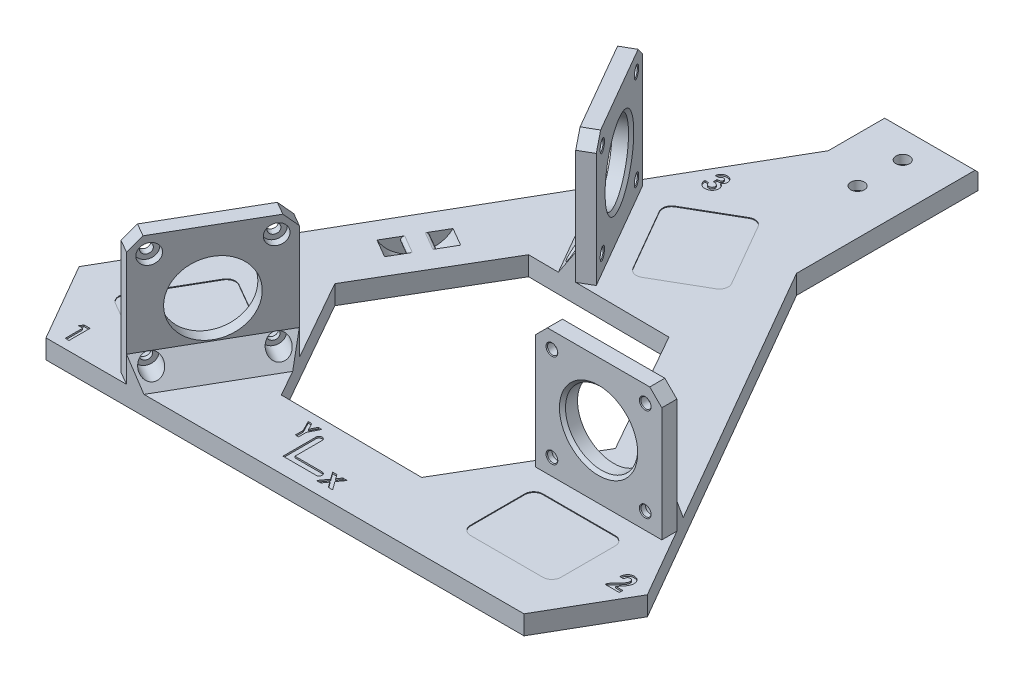
from build123d import *

# Parameters (mm, degrees)
SKETCH1_W                    = 555
SKETCH1_H                    = 555
BOSS_EXTRUDE1_DEPTH          = 6.35
SKETCH4_W                    = 42
SKETCH4_H                    = 5
BOSS_EXTRUDE3_DEPTH          = 42
SKETCH5_R                    = 12
CUT_EXTRUDE1_DEPTH           = 42
CHAMFER2_SIZE                = 1
CHAMFER1_SIZE                = 4
CUT_EXTRUDE7_DEPTH           = 0.25
CIRPATTERN2_COUNT            = 3
CHAMFER2_OF_CIRPATTERN2_SIZE = 1
CHAMFER1_OF_CIRPATTERN2_SIZE = 4
CUT_EXTRUDE2_DEPTH           = 10
SKETCH12_W                   = 555
SKETCH12_H                   = 555
CUT_EXTRUDE3_DEPTH           = 10
CHAMFER3_SIZE                = 30
CHAMFER3_EDGE_2_SIZE         = 30
CHAMFER3_EDGE_3_SIZE         = 30
CHAMFER4_SIZE                = 5
CHAMFER4_SIZE_2              = 8.660254038
MOVE_FACE2_BY                = 0.75
MOVE_FACE2_2_BY              = 0.75
MOVE_FACE3_BY                = 0.75
MOVE_FACE3_2_BY              = 0.75
MOVE_FACE4_BY                = 0.75
MOVE_FACE4_2_BY              = 0.75
SKETCH24_R                   = 10.5
SKETCH24_R_2                 = 7.5
CUT_EXTRUDE6_DEPTH           = 3.5
FILLET2_R                    = 1
CUT_EXTRUDE8_DEPTH           = 0.5
BOSS_EXTRUDE7_DEPTH          = 6.35
CHAMFER7_SIZE                = 1
M4_CLEARANCE_HOLE1_D         = 4.5
CUT_EXTRUDE9_DEPTH           = 3.3
CHAMFER8_SIZE                = 0.5
CHAMFER9_SIZE                = 11.5
CHAMFER9_SIZE2               = 19.918584287
DELETEFACE1_START            = -63.148057707
DELETEFACE1_DEPTH            = 0.173205081
CUT_EXTRUDE10_START          = 175.99903753
CUT_EXTRUDE10_DEPTH          = 176.19903753
LPATTERN1_COUNT              = 2
LPATTERN1_PITCH              = 15


with BuildPart() as part:
    # Sketch1 → Boss-Extrude1 (new body)
    with BuildSketch(Plane(origin=(0, 0, 0), x_dir=(1, 0, 0), z_dir=(0, 1, 0))):
        Rectangle(SKETCH1_W, SKETCH1_H)
    extrude(amount=BOSS_EXTRUDE1_DEPTH)

    # Sketch4 → Boss-Extrude3 (add)
    with BuildSketch(Plane(origin=(0, 6.35, 0), x_dir=(1, 0, 0), z_dir=(0, 1, 0))):
        with Locations((60, -16.5)):
            Rectangle(SKETCH4_W, SKETCH4_H)
    boss_extrude3 = extrude(amount=BOSS_EXTRUDE3_DEPTH)

    # Sketch5 → Cut-Extrude1 (cut)
    with BuildSketch(Plane.XY.offset(19)):
        with Locations((60, 27.35)):
            Circle(SKETCH5_R)
    cut_extrude1 = extrude(amount=-CUT_EXTRUDE1_DEPTH, mode=Mode.SUBTRACT)

    # CBORE for M3 SHCS1: read off the stored shape, not the designer's step
    # CBORE for M3 SHCS1 outline → CBORE for M3 SHCS1 (revolve, cut)
    with BuildSketch(Plane(origin=(75.5, 11.85, 0), x_dir=(1, 0, 0), z_dir=(0, -1, 0))):
        Polygon((1.95, 19), (0, 19), (0, 14), (3.25, 14), (3.25, 16.5), (1.7, 16.5), (1.7, 18.75), align=None)
    cbore_for_m3_shcs1 = revolve(axis=Axis((75.5, 11.85, 0), (0, 0, 1)), mode=Mode.SUBTRACT)

    # CBORE for M3 SHCS1 2 outline → CBORE for M3 SHCS1 2 (revolve, cut)
    with BuildSketch(Plane(origin=(44.5, 42.85, 0), x_dir=(1, 0, 0), z_dir=(0, -1, 0))):
        Polygon((0, 14), (3.25, 14), (3.25, 16.5), (1.7, 16.5), (1.7, 18.75), (1.95, 19), (0, 19), align=None)
    cbore_for_m3_shcs1_2 = revolve(axis=Axis((44.5, 42.85, 0), (0, 0, 1)), mode=Mode.SUBTRACT)

    # CBORE for M3 SHCS1 3 outline → CBORE for M3 SHCS1 3 (revolve, cut)
    with BuildSketch(Plane(origin=(44.5, 11.85, 0), x_dir=(1, 0, 0), z_dir=(0, -1, 0))):
        Polygon((0, 14), (3.25, 14), (3.25, 16.5), (1.7, 16.5), (1.7, 18.75), (1.95, 19), (0, 19), align=None)
    cbore_for_m3_shcs1_3 = revolve(axis=Axis((44.5, 11.85, 0), (0, 0, 1)), mode=Mode.SUBTRACT)

    # CBORE for M3 SHCS1 4 outline → CBORE for M3 SHCS1 4 (revolve, cut)
    with BuildSketch(Plane(origin=(75.5, 42.85, 0), x_dir=(1, 0, 0), z_dir=(0, -1, 0))):
        Polygon((0, 14), (3.25, 14), (3.25, 16.5), (1.7, 16.5), (1.7, 18.75), (1.95, 19), (0, 19), align=None)
    cbore_for_m3_shcs1_4 = revolve(axis=Axis((75.5, 42.85, 0), (0, 0, 1)), mode=Mode.SUBTRACT)

    # Chamfer2
    chamfer2_edges = [part.edges().sort_by_distance(p)[0] for p in [
        (48, 27.35, 19),
    ]]
    chamfer(chamfer2_edges, length=CHAMFER2_SIZE)

    # Chamfer1
    chamfer1_edges = [part.edges().sort_by_distance(p)[0] for p in [
        (81, 48.35, 16.5),
        (39, 48.35, 16.5),
    ]]
    chamfer(chamfer1_edges, length=CHAMFER1_SIZE)

    # Sketch25 → Cut-Extrude7 (cut)
    with BuildSketch(Plane(origin=(0, 6.35, 0), x_dir=(1, 0, 0), z_dir=(0, 1, 0))):
        with BuildLine():
            Line((48, -49.5), (72, -49.5))
            ThreePointArc((72, -49.5), (74.121320344, -48.621320344), (75, -46.5))
            Line((75, -46.5), (75, -28.5))
            ThreePointArc((75, -28.5), (74.121320344, -26.378679656), (72, -25.5))
            Line((72, -25.5), (48, -25.5))
            ThreePointArc((48, -25.5), (45.878679656, -26.378679656), (45, -28.5))
            Line((45, -28.5), (45, -46.5))
            ThreePointArc((45, -46.5), (45.878679656, -48.621320344), (48, -49.5))
        make_face()
    cut_extrude7 = extrude(amount=-CUT_EXTRUDE7_DEPTH, mode=Mode.SUBTRACT)

    # CirPattern2: Boss-Extrude3, Cut-Extrude1, CBORE for M3 SHCS1, CBORE for M3 SHCS1 2, CBORE for M3 SHCS1 3, CBORE for M3 SHCS1 4, Cut-Extrude7 ×3 about axis
    cirpattern2_axis = Axis((0, 0, 0), (0, 1, 0))
    add([boss_extrude3.rotate(cirpattern2_axis, i * 360 / CIRPATTERN2_COUNT) for i in range(1, CIRPATTERN2_COUNT)])
    add([cut_extrude1.rotate(cirpattern2_axis, i * 360 / CIRPATTERN2_COUNT) for i in range(1, CIRPATTERN2_COUNT)], mode=Mode.SUBTRACT)
    add([cbore_for_m3_shcs1.rotate(cirpattern2_axis, i * 360 / CIRPATTERN2_COUNT) for i in range(1, CIRPATTERN2_COUNT)], mode=Mode.SUBTRACT)
    add([cbore_for_m3_shcs1_2.rotate(cirpattern2_axis, i * 360 / CIRPATTERN2_COUNT) for i in range(1, CIRPATTERN2_COUNT)], mode=Mode.SUBTRACT)
    add([cbore_for_m3_shcs1_3.rotate(cirpattern2_axis, i * 360 / CIRPATTERN2_COUNT) for i in range(1, CIRPATTERN2_COUNT)], mode=Mode.SUBTRACT)
    add([cbore_for_m3_shcs1_4.rotate(cirpattern2_axis, i * 360 / CIRPATTERN2_COUNT) for i in range(1, CIRPATTERN2_COUNT)], mode=Mode.SUBTRACT)
    add([cut_extrude7.rotate(cirpattern2_axis, i * 360 / CIRPATTERN2_COUNT) for i in range(1, CIRPATTERN2_COUNT)], mode=Mode.SUBTRACT)

    # Chamfer2 of CirPattern2
    chamfer2_of_cirpattern2_edges = [part.edges().sort_by_distance(p)[0] for p in [
        (-7.545517328, 27.35, -51.069219382),
        (-40.454482672, 27.35, 32.069219382),
    ]]
    chamfer(chamfer2_of_cirpattern2_edges, length=CHAMFER2_OF_CIRPATTERN2_SIZE)

    # Chamfer1 of CirPattern2
    chamfer1_of_cirpattern2_edges = [part.edges().sort_by_distance(p)[0] for p in [
        (-26.210580838, 48.35, -78.398057707),
        (-5.210580838, 48.35, -42.024990748),
        (-54.789419162, 48.35, 61.898057707),
        (-33.789419162, 48.35, 25.524990748),
    ]]
    chamfer(chamfer1_of_cirpattern2_edges, length=CHAMFER1_OF_CIRPATTERN2_SIZE)

    # Sketch11 → Cut-Extrude2 (cut)
    with BuildSketch(Plane(origin=(0, 6.35, 0), x_dir=(1, 0, 0), z_dir=(0, 1, 0))):
        Polygon((23.1548669, -40.910041233), (47.006568428, -0.402317659), (23.851701527, 40.507723574), (-23.1548669, 40.910041233), (-47.006568428, 0.402317659), (-23.851701527, -40.507723574), align=None)
    extrude(amount=-CUT_EXTRUDE2_DEPTH, mode=Mode.SUBTRACT)

    # Sketch12 → Cut-Extrude3 (cut)
    with BuildSketch(Plane(origin=(0, 6.35, 0), x_dir=(1, 0, 0), z_dir=(0, 1, 0))):
        Rectangle(SKETCH12_W, SKETCH12_H)
        Polygon((0, 126.296115413), (-109.375644347, -63.148057707), (109.375644347, -63.148057707), align=None, mode=Mode.SUBTRACT)
    extrude(amount=-CUT_EXTRUDE3_DEPTH, mode=Mode.SUBTRACT)

    # Chamfer3
    chamfer3_edges = [part.edges().sort_by_distance(p)[0] for p in [
        (109.375644347, 3.175, 63.148057707),
    ]]
    chamfer(chamfer3_edges, length=CHAMFER3_SIZE)

    # Chamfer3 edge 2
    chamfer3_edge_2_edges = [part.edges().sort_by_distance(p)[0] for p in [
        (-109.375644347, 3.175, 63.148057707),
    ]]
    chamfer(chamfer3_edge_2_edges, length=CHAMFER3_EDGE_2_SIZE)

    # Chamfer3 edge 3
    chamfer3_edge_3_edges = [part.edges().sort_by_distance(p)[0] for p in [
        (0, 3.175, -126.296115413),
    ]]
    chamfer(chamfer3_edge_3_edges, length=CHAMFER3_EDGE_3_SIZE)

    # Chamfer4
    # the kernel refuses this chamfer: 8.660254038, 5 mm, written as the material it adds along each edge
    with BuildSketch(Plane(origin=(-7.375644347, 6.35, -40.774990748), x_dir=(-0.8660254037844387, 0, 0.49999999999999983), z_dir=(-0.49999999999999983, 0, -0.8660254037844388))) as chamfer4_piece_1_section:
        Polygon((CHAMFER4_SIZE, 0), (0, CHAMFER4_SIZE_2), (0, 0), align=None)
    chamfer4_piece_1 = extrude(amount=42, mode=Mode.PRIVATE)
    chamfer4_piece_1 = split(chamfer4_piece_1, bisect_by=Plane(origin=(-38.875644347, 6.35, -58.961524227), z_dir=(0.8660254037844387, 0, 0.49999999999999994)), keep=Keep.TOP, mode=Mode.PRIVATE)
    chamfer4_piece_1 = split(chamfer4_piece_1, bisect_by=Plane(origin=(-7.375644347, 6.35, -40.774990748), z_dir=(0.008558440626697767, 0, -0.9999633758763565)), keep=Keep.TOP, mode=Mode.PRIVATE)
    chamfer4_piece_1 = chamfer4_piece_1 - Plane(origin=(-10.125644347, 11.85, -45.538130468), x_dir=(-0.49999999999999983, 0, -0.8660254037844388), z_dir=(0.8660254037844388, 0, -0.49999999999999983)) * Cylinder(3.25, 119, mode=Mode.PRIVATE)
    chamfer4_piece_1 = chamfer4_piece_1 - Plane(origin=(-25.625644347, 11.85, -72.384917986), x_dir=(-0.49999999999999983, 0, -0.8660254037844388), z_dir=(0.8660254037844388, 0, -0.49999999999999983)) * Cylinder(3.25, 119, mode=Mode.PRIVATE)
    add(chamfer4_piece_1)
    with BuildSketch(Plane(origin=(-31.624355653, 6.35, 26.774990748), x_dir=(0.8660254037844384, 0, 0.5000000000000004), z_dir=(-0.5000000000000004, 0, 0.8660254037844384))) as chamfer4_piece_2_section:
        Polygon((CHAMFER4_SIZE, 0), (0, CHAMFER4_SIZE_2), (0, 0), align=None)
    chamfer4_piece_2 = extrude(amount=42, mode=Mode.PRIVATE)
    chamfer4_piece_2 = split(chamfer4_piece_2, bisect_by=Plane(origin=(-31.624355653, 6.35, 63.148057707), z_dir=(0, 0, -1)), keep=Keep.TOP, mode=Mode.PRIVATE)
    chamfer4_piece_2 = split(chamfer4_piece_2, bisect_by=Plane(origin=(-31.624355653, 6.35, 26.774990748), z_dir=(-0.8702729066763208, 0, 0.49256986093867716)), keep=Keep.TOP, mode=Mode.PRIVATE)
    chamfer4_piece_2 = chamfer4_piece_2 - Plane(origin=(-34.374355653, 11.85, 31.538130468), x_dir=(-0.5000000000000004, 0, 0.8660254037844384), z_dir=(-0.8660254037844384, 0, -0.5000000000000004)) * Cylinder(3.25, 119, mode=Mode.PRIVATE)
    chamfer4_piece_2 = chamfer4_piece_2 - Plane(origin=(-49.874355653, 11.85, 58.384917986), x_dir=(-0.5000000000000004, 0, 0.8660254037844384), z_dir=(-0.8660254037844384, 0, -0.5000000000000004)) * Cylinder(3.25, 119, mode=Mode.PRIVATE)
    add(chamfer4_piece_2)
    with BuildSketch(Plane(origin=(39, 6.35, 14), x_dir=(0, 0, -1), z_dir=(1, 0, 0))) as chamfer4_piece_3_section:
        Polygon((CHAMFER4_SIZE, 0), (0, CHAMFER4_SIZE_2), (0, 0), align=None)
    chamfer4_piece_3 = extrude(amount=42, mode=Mode.PRIVATE)
    chamfer4_piece_3 = split(chamfer4_piece_3, bisect_by=Plane(origin=(70.5, 6.35, -4.186533479), z_dir=(-0.8660254037844386, 0, 0.5000000000000001)), keep=Keep.TOP, mode=Mode.PRIVATE)
    chamfer4_piece_3 = split(chamfer4_piece_3, bisect_by=Plane(origin=(39, 6.35, 14), z_dir=(0.8617144660496233, 0, 0.507393514937679)), keep=Keep.TOP, mode=Mode.PRIVATE)
    chamfer4_piece_3 = chamfer4_piece_3 - Plane(origin=(44.5, 11.85, 14), x_dir=(1, 0, 0), z_dir=(0, 0, 1)) * Cylinder(3.25, 119, mode=Mode.PRIVATE)
    chamfer4_piece_3 = chamfer4_piece_3 - Plane(origin=(75.5, 11.85, 14), x_dir=(1, 0, 0), z_dir=(0, 0, 1)) * Cylinder(3.25, 119, mode=Mode.PRIVATE)
    add(chamfer4_piece_3)

    # Move Face2: a face moved inward by 0.75
    extrude(part.faces().sort_by_distance((44.5, 9.25, 16.5))[0], amount=MOVE_FACE2_BY, dir=(0, 0, 1), mode=Mode.SUBTRACT)

    # Move Face2 2: a face moved inward by 0.75
    extrude(part.faces().sort_by_distance((75.5, 9.25, 16.5))[0], amount=MOVE_FACE2_2_BY, dir=(0, 0, 1), mode=Mode.SUBTRACT)

    # Move Face3: a face moved inward by 0.75
    extrude(part.faces().sort_by_distance((-23.460580838, 9.25, -73.634917986))[0], amount=MOVE_FACE3_BY, dir=(0.866025404, 0, -0.5), mode=Mode.SUBTRACT)

    # Move Face3 2: a face moved inward by 0.75
    extrude(part.faces().sort_by_distance((-7.960580838, 9.25, -46.788130468))[0], amount=MOVE_FACE3_2_BY, dir=(0.866025404, 0, -0.5), mode=Mode.SUBTRACT)

    # Move Face4: a face moved inward by 0.75
    extrude(part.faces().sort_by_distance((-52.039419162, 9.25, 57.134917986))[0], amount=MOVE_FACE4_BY, dir=(-0.866025404, 0, -0.5), mode=Mode.SUBTRACT)

    # Move Face4 2: a face moved inward by 0.75
    extrude(part.faces().sort_by_distance((-36.539419162, 9.25, 30.288130468))[0], amount=MOVE_FACE4_2_BY, dir=(-0.866025404, 0, -0.5), mode=Mode.SUBTRACT)

    # Sketch24 → Cut-Extrude6 (cut, symmetric)
    with BuildSketch(Plane(origin=(-44.86090955, 0, -26.157056478), x_dir=(-0.5037013693952612, 0, 0.8638778446454908), z_dir=(-0.8638778446454909, 0, -0.5037013693952612))):
        with Locations((0, 11.35)):
            Circle(SKETCH24_R)
        with Locations((0, 11.35)):
            Circle(SKETCH24_R_2, mode=Mode.SUBTRACT)
    extrude(amount=CUT_EXTRUDE6_DEPTH, both=True, mode=Mode.SUBTRACT)

    # Fillet2
    fillet2_edges = [part.edges().sort_by_distance(p)[0] for p in [
        (-47.676685805, 6.35, -21.327832516),
        (-42.045133294, 6.35, -30.98628044),
    ]]
    fillet(fillet2_edges, radius=FILLET2_R)

    # Sketch45 → Cut-Extrude8 (cut)
    with BuildSketch(Plane(origin=(0, 6.35, 0), x_dir=(1, 0, 0), z_dir=(0, 1, 0))):
        with BuildLine():
            Line((-6, -46.82789064), (-6, -57.82789064))
            Line((-6, -57.82789064), (5, -57.82789064))
            ThreePointArc((5, -57.82789064), (6, -56.82789064), (5, -55.82789064))
            Line((5, -55.82789064), (-4, -55.82789064))
            Line((-4, -55.82789064), (-4, -46.82789064))
            ThreePointArc((-4, -46.82789064), (-5, -45.82789064), (-6, -46.82789064))
        make_face()
        Polygon((6.818880885, -54.15780537), (8.236549154, -54.15780537), (9.247566782, -55.551635498), (10.25437768, -54.15780537), (11.672045949, -54.15780537), (9.958504282, -56.531803767), (11.946885693, -59.273189985), (10.529217424, -59.273189985), (9.251773513, -57.511972037), (7.979938577, -59.273189985), (6.562270308, -59.273189985), (8.540836013, -56.531803767), align=None)
        Polygon((-11.764829471, -43.673055965), (-10.566512163, -43.673055965), (-9.495598702, -45.777623273), (-8.42468524, -43.673055965), (-7.226367932, -43.673055965), (-8.957137163, -47.074498273), (-8.957137163, -49.673055965), (-10.03406024, -49.673055965), (-10.03406024, -47.074498273), align=None)
        Polygon((-76.742247776, -53.097056315), (-74.800140405, -53.097056315), (-74.800140405, -60.097056315), (-76.056550661, -60.097056315), (-76.056550661, -54.263722982), (-77.492448097, -54.263722982), align=None)
        with BuildLine():
            Line((85.839109368, -36.529038549), (84.582699111, -36.529038549))
            add(Edge.make_bspline(
                [(84.582699111, -36.529038549), (84.588125355, -36.43399776), (84.598727908, -36.248293764), (84.640902186, -35.978552765), (84.697414271, -35.723677182), (84.77283715, -35.484558599), (84.867610933, -35.261283903), (84.979296846, -35.053091939), (85.11074821, -34.861078843), (85.259167308, -34.686170608), (85.422034392, -34.529258818), (85.595968181, -34.390130966), (85.783629228, -34.275326165), (85.981588811, -34.180852442), (86.189813221, -34.105372327), (86.41027259, -34.054907762), (86.641058059, -34.020732665), (86.799049401, -34.017742207), (86.879574111, -34.016218036)],
                knots=[0, 0, 0, 0, 1.199038563, 2.342849363, 3.436047546, 4.486744587, 5.497670872, 6.488682221, 7.459191391, 8.424610317, 9.374430501, 10.305433194, 11.225809216, 12.140057399, 13.06607119, 14.010487599, 14.985989317, 16, 16, 16, 16], degree=3))
            add(Edge.make_bspline(
                [(86.879574111, -34.016218036), (86.97841705, -34.019302196), (87.171381631, -34.0253232), (87.451774472, -34.076684359), (87.713630729, -34.162593834), (87.956760056, -34.282632028), (88.179092651, -34.43512797), (88.380591645, -34.616954423), (88.555163386, -34.831926201), (88.703914712, -35.071098681), (88.827509285, -35.324348675), (88.914119214, -35.586219672), (88.971046988, -35.849762675), (88.977118688, -36.027219194), (88.980135009, -36.11537669)],
                knots=[0, 0, 0, 0, 1.075374347, 2.099382735, 3.09057751, 4.06680945, 5.040638231, 6.016817125, 7.011024321, 8.044445721, 9.0776792, 10.070479129, 11.0414456, 12, 12, 12, 12], degree=3))
            add(Edge.make_bspline(
                [(88.980135009, -36.11537669), (88.978960613, -36.168700574), (88.976596843, -36.27602838), (88.960161242, -36.438441694), (88.935504592, -36.603878642), (88.898328373, -36.772197378), (88.851966579, -36.943445085), (88.795723023, -37.118134248), (88.728293079, -37.295274443), (88.650802016, -37.476859353), (88.558354982, -37.663478513), (88.450713261, -37.857929418), (88.325019797, -38.060039573), (88.18279281, -38.270950158), (88.023341537, -38.490328536), (87.84588759, -38.717513869), (87.65247482, -38.953306686), (87.515204337, -39.110920952), (87.444678278, -39.191899126)],
                knots=[0, 0, 0, 0, 0.728284026, 1.46585585, 2.227944881, 3.01186502, 3.81876927, 4.650621989, 5.517437689, 6.406905708, 7.346299482, 8.360816762, 9.441613733, 10.596154504, 11.834900912, 13.145207542, 14.533280747, 16, 16, 16, 16], degree=3))
            Line((87.444678278, -39.191899126), (86.714109368, -40.029038549))
            Line((86.714109368, -40.029038549), (89.069878598, -40.029038549))
            Line((89.069878598, -40.029038549), (89.069878598, -41.195705215))
            Line((89.069878598, -41.195705215), (84.403211932, -41.195705215))
            Line((84.403211932, -41.195705215), (84.403211932, -40.559086626))
            Line((84.403211932, -40.559086626), (86.475727957, -38.353357459))
            add(Edge.make_bspline(
                [(86.475727957, -38.353357459), (86.535732622, -38.289015654), (86.651943863, -38.164404659), (86.817300483, -37.981400156), (86.966933618, -37.807733251), (87.097740502, -37.641554742), (87.216585712, -37.488254783), (87.31816995, -37.343212722), (87.403422632, -37.207739792), (87.495976511, -37.044383098), (87.58387227, -36.849551172), (87.664521949, -36.625096804), (87.71368351, -36.410570122), (87.72046936, -36.270779924), (87.723724752, -36.203718036)],
                knots=[0, 0, 0, 0, 1.246127091, 2.413378631, 3.493388633, 4.492180848, 5.408488754, 6.240484944, 6.999099869, 7.674939598, 8.898438119, 10.020720584, 11.050475521, 12, 12, 12, 12], degree=3))
            add(Edge.make_bspline(
                [(87.723724752, -36.203718036), (87.721290774, -36.138840833), (87.716574551, -36.013130851), (87.664747085, -35.83430907), (87.584454176, -35.672404203), (87.471310128, -35.532254148), (87.334257249, -35.417083554), (87.175879774, -35.331422903), (86.997468944, -35.281997099), (86.872399553, -35.275810754), (86.808059688, -35.272628292)],
                knots=[0, 0, 0, 0, 1.062038974, 2.057870785, 3.028805853, 4.01125022, 4.991535629, 5.949134679, 6.94496649, 8, 8, 8, 8], degree=3))
            add(Edge.make_bspline(
                [(86.808059688, -35.272628292), (86.774820894, -35.273803932), (86.709384991, -35.276118367), (86.613199327, -35.291524937), (86.521671757, -35.318677409), (86.433783529, -35.355057899), (86.350472609, -35.4032805), (86.271949133, -35.462722539), (86.197385757, -35.531873457), (86.127124459, -35.610517031), (86.063177506, -35.698283281), (86.006380056, -35.794370645), (85.95941802, -35.898719476), (85.918070937, -36.009952211), (85.886182087, -36.129263581), (85.862963049, -36.25593952), (85.845311165, -36.389773943), (85.841214241, -36.481772524), (85.839109368, -36.529038549)],
                knots=[0, 0, 0, 0, 0.903469896, 1.778625579, 2.63899355, 3.493148037, 4.358286772, 5.247621495, 6.164656832, 7.118446693, 8.109501108, 9.111810964, 10.146451449, 11.215617525, 12.33435995, 13.498009769, 14.714554818, 16, 16, 16, 16], degree=3))
        make_face()
        with BuildLine():
            Line((-13.651608969, 94.695324564), (-14.908019225, 94.695324564))
            add(Edge.make_bspline(
                [(-14.908019225, 94.695324564), (-14.899148491, 94.75812803), (-14.881758004, 94.881250066), (-14.840144895, 95.059500103), (-14.790371126, 95.228582462), (-14.728231118, 95.387961693), (-14.655350998, 95.537921705), (-14.572471875, 95.678977086), (-14.478697796, 95.810522401), (-14.40681897, 95.88976582), (-14.37095993, 95.929298923)],
                knots=[0, 0, 0, 0, 1.111473889, 2.178970933, 3.205615836, 4.199322666, 5.174200091, 6.12565194, 7.064921805, 8, 8, 8, 8], degree=3))
            add(Edge.make_bspline(
                [(-14.37095993, 95.929298923), (-14.319238017, 95.981459987), (-14.21729956, 96.084263962), (-14.046948444, 96.215944499), (-13.868389014, 96.329905048), (-13.678040183, 96.420253796), (-13.478863923, 96.493380641), (-13.269276313, 96.542500107), (-13.050133807, 96.575091307), (-12.900596614, 96.578301654), (-12.824285251, 96.579939948)],
                knots=[0, 0, 0, 0, 1.01925491, 2.00884431, 2.983262333, 3.955970413, 4.92937149, 5.924503185, 6.940838805, 8, 8, 8, 8], degree=3))
            add(Edge.make_bspline(
                [(-12.824285251, 96.579939948), (-12.756440522, 96.578338267), (-12.623071457, 96.575189685), (-12.42705249, 96.549914575), (-12.240164809, 96.505584847), (-12.060432956, 96.447624722), (-11.890500203, 96.368760285), (-11.726615967, 96.277215459), (-11.573359181, 96.164931927), (-11.430371252, 96.038062835), (-11.299009569, 95.900841492), (-11.185249775, 95.754163162), (-11.087448439, 95.60194596), (-11.006873075, 95.44292525), (-10.944921569, 95.276831949), (-10.901925387, 95.104625556), (-10.873783341, 94.926686057), (-10.870979658, 94.805742977), (-10.869557687, 94.744403089)],
                knots=[0, 0, 0, 0, 1.091422571, 2.145516843, 3.172569842, 4.178562979, 5.178154469, 6.181868002, 7.194278174, 8.227918432, 9.254613415, 10.245994977, 11.209837596, 12.161663635, 13.10878368, 14.055455738, 15.013766427, 16, 16, 16, 16], degree=3))
            add(Edge.make_bspline(
                [(-10.869557687, 94.744403089), (-10.872475657, 94.668438746), (-10.878220243, 94.51888831), (-10.925358734, 94.300010135), (-10.99914329, 94.09072354), (-11.105732259, 93.893956758), (-11.238995617, 93.710245279), (-11.402505294, 93.545731127), (-11.59160411, 93.397834946), (-11.73356311, 93.31835552), (-11.806256405, 93.277656294)],
                knots=[0, 0, 0, 0, 0.992805628, 1.954529043, 2.915727527, 3.886831945, 4.871318353, 5.87440735, 6.911542536, 8, 8, 8, 8], degree=3))
            add(Edge.make_bspline(
                [(-11.806256405, 93.277656294), (-11.756360842, 93.261274531), (-11.6583183, 93.2290851), (-11.518962615, 93.16568838), (-11.386451282, 93.096406273), (-11.263066099, 93.015918729), (-11.147579851, 92.927480306), (-11.040696556, 92.830335001), (-10.941777611, 92.724694636), (-10.852437828, 92.609978229), (-10.77314528, 92.488020447), (-10.702000299, 92.36163844), (-10.643444014, 92.228915604), (-10.59383955, 92.091367723), (-10.556073536, 91.947758588), (-10.529482887, 91.798644674), (-10.514112839, 91.644366119), (-10.511768645, 91.539842491), (-10.510583328, 91.48699123)],
                knots=[0, 0, 0, 0, 1.059543567, 2.081955587, 3.086750234, 4.076226789, 5.052108497, 6.020845489, 6.989030705, 7.970690546, 8.952259656, 9.923888338, 10.895517021, 11.877585046, 12.873342345, 13.889638361, 14.932918083, 16, 16, 16, 16], degree=3))
            add(Edge.make_bspline(
                [(-10.510583328, 91.48699123), (-10.512986125, 91.409321335), (-10.51772395, 91.256172121), (-10.54784483, 91.030599001), (-10.60392448, 90.815535072), (-10.677700367, 90.6085057), (-10.776109392, 90.412183558), (-10.891920271, 90.22206332), (-11.03427511, 90.044738305), (-11.19247807, 89.875520497), (-11.36817168, 89.721675244), (-11.558652137, 89.588298332), (-11.759730936, 89.473837211), (-11.972680249, 89.380914412), (-12.19742609, 89.309353229), (-12.433467522, 89.257625508), (-12.681796325, 89.225977632), (-12.851300163, 89.222659952), (-12.937866982, 89.220965589)],
                knots=[0, 0, 0, 0, 1.005138573, 1.981928558, 2.936866704, 3.876260664, 4.820238198, 5.773547, 6.751179199, 7.756627054, 8.768222608, 9.766606018, 10.760583154, 11.757261445, 12.767156078, 13.807575856, 14.880313354, 16, 16, 16, 16], degree=3))
            add(Edge.make_bspline(
                [(-12.937866982, 89.220965589), (-13.019757796, 89.222752008), (-13.179884447, 89.226245114), (-13.414103187, 89.256479717), (-13.636705928, 89.305250584), (-13.848260758, 89.373997165), (-14.047949187, 89.463149733), (-14.237582067, 89.569310438), (-14.413375317, 89.698602382), (-14.577287619, 89.845189082), (-14.725682903, 90.009651037), (-14.858313341, 90.188178566), (-14.972254409, 90.381450538), (-15.067973379, 90.588641212), (-15.144721946, 90.810114065), (-15.205260991, 91.04541872), (-15.247548504, 91.295014889), (-15.260427255, 91.466742363), (-15.266993584, 91.554298923)],
                knots=[0, 0, 0, 0, 1.066544725, 2.085487077, 3.070979577, 4.031932826, 4.977951092, 5.916076795, 6.857635327, 7.814973522, 8.776389752, 9.738577119, 10.707772778, 11.69409279, 12.707140348, 13.757286496, 14.856535458, 16, 16, 16, 16], degree=3))
            Line((-15.266993584, 91.554298923), (-14.010583328, 91.554298923))
            add(Edge.make_bspline(
                [(-14.010583328, 91.554298923), (-14.002621587, 91.510274335), (-13.987114009, 91.424524906), (-13.956867429, 91.300378795), (-13.917451915, 91.185784267), (-13.871877775, 91.079722808), (-13.822650842, 90.98080187), (-13.763172936, 90.892674846), (-13.697802284, 90.812948726), (-13.603471957, 90.718169436), (-13.468620257, 90.620787672), (-13.286525786, 90.536158287), (-13.083962932, 90.48655507), (-12.942351295, 90.48050363), (-12.869157046, 90.477375846)],
                knots=[0, 0, 0, 0, 0.928156231, 1.807827665, 2.648129825, 3.438902246, 4.202261636, 4.936546065, 5.639352463, 6.338805438, 7.70633318, 9.064371875, 10.482673459, 12, 12, 12, 12], degree=3))
            add(Edge.make_bspline(
                [(-12.869157046, 90.477375846), (-12.83031759, 90.478041878), (-12.754239786, 90.479346486), (-12.642492819, 90.493806318), (-12.536038099, 90.517621674), (-12.434677349, 90.549985859), (-12.337765299, 90.590556388), (-12.247153551, 90.642869658), (-12.160995212, 90.703691302), (-12.080226901, 90.772070976), (-12.005595317, 90.846580344), (-11.94349745, 90.929086809), (-11.886744493, 91.012928124), (-11.844769597, 91.103589484), (-11.807990546, 91.196192339), (-11.785479887, 91.294097881), (-11.768482724, 91.395252317), (-11.767494917, 91.464477972), (-11.766993584, 91.499611423)],
                knots=[0, 0, 0, 0, 1.110435564, 2.175094844, 3.216326037, 4.226890168, 5.215276772, 6.21526065, 7.213097102, 8.228249917, 9.239874822, 10.221364777, 11.178138315, 12.128914389, 13.072518965, 14.022636769, 14.996447288, 16, 16, 16, 16], degree=3))
            add(Edge.make_bspline(
                [(-11.766993584, 91.499611423), (-11.768324528, 91.538035837), (-11.770974132, 91.614530041), (-11.792621675, 91.726157248), (-11.826807721, 91.833533625), (-11.874296315, 91.936183657), (-11.937712039, 92.033728999), (-12.012541886, 92.128126704), (-12.10468121, 92.214463541), (-12.205770389, 92.299804888), (-12.322994123, 92.374196803), (-12.450643452, 92.44284961), (-12.5920732, 92.49747605), (-12.743830938, 92.546267579), (-12.908787308, 92.581904153), (-13.08591799, 92.60777978), (-13.274937248, 92.627040174), (-13.405230679, 92.629803395), (-13.472121789, 92.631221999)],
                knots=[0, 0, 0, 0, 0.809814727, 1.612155564, 2.388397, 3.182215007, 3.988903953, 4.837162975, 5.715530372, 6.646997145, 7.623086902, 8.637258368, 9.698941581, 10.815059213, 11.996518529, 13.252603015, 14.589518788, 16, 16, 16, 16], degree=3))
            Line((-13.472121789, 92.631221999), (-13.472121789, 93.797888666))
            add(Edge.make_bspline(
                [(-13.472121789, 93.797888666), (-13.388838378, 93.804981348), (-13.233031609, 93.818250351), (-13.016763459, 93.849280376), (-12.834693555, 93.890757113), (-12.682445844, 93.940796551), (-12.5560291, 94.005060226), (-12.44559213, 94.076004486), (-12.350478588, 94.158395875), (-12.270094886, 94.249777494), (-12.205790425, 94.347912784), (-12.160279474, 94.451276432), (-12.130226419, 94.556670238), (-12.127378895, 94.628756425), (-12.125967943, 94.664475205)],
                knots=[0, 0, 0, 0, 1.70044513, 3.18119609, 4.440695891, 5.496282586, 6.431922213, 7.318171381, 8.16090191, 8.983045123, 9.787564368, 10.536848927, 11.275007137, 12, 12, 12, 12], degree=3))
            add(Edge.make_bspline(
                [(-12.125967943, 94.664475205), (-12.128402238, 94.710048489), (-12.133153467, 94.798997893), (-12.170054081, 94.926303227), (-12.234109367, 95.039785381), (-12.319996257, 95.139205556), (-12.424652419, 95.222248738), (-12.547327788, 95.282536672), (-12.6853603, 95.317958525), (-12.78247361, 95.321630578), (-12.832698712, 95.323529692)],
                knots=[0, 0, 0, 0, 1.009664648, 1.970651636, 2.907870547, 3.878035693, 4.867062054, 5.849714035, 6.887914197, 8, 8, 8, 8], degree=3))
            add(Edge.make_bspline(
                [(-12.832698712, 95.323529692), (-12.878222121, 95.321288937), (-12.968554506, 95.316842594), (-13.100647492, 95.283656266), (-13.226091819, 95.227791213), (-13.34228989, 95.150756597), (-13.447564363, 95.058241289), (-13.533964331, 94.948676109), (-13.605827729, 94.828625299), (-13.63628873, 94.739932334), (-13.651608969, 94.695324564)],
                knots=[0, 0, 0, 0, 0.98818071, 1.960853194, 2.938124878, 3.957524365, 4.978590984, 5.968022688, 6.978025184, 8, 8, 8, 8], degree=3))
        make_face()
    extrude(amount=-CUT_EXTRUDE8_DEPTH, mode=Mode.SUBTRACT)

    # Sketch46 → Boss-Extrude7 (add)
    with BuildSketch(Plane(origin=(0, 6.35, 0), x_dir=(1, 0, 0), z_dir=(0, 1, 0))):
        Polygon((26.7, 140.3153533), (-3.3, 140.3153533), (-3.3, 100.3153533), (15, 100.3153533), (26.7, 80.050358851), align=None)
    extrude(amount=-BOSS_EXTRUDE7_DEPTH)

    # Chamfer7
    chamfer7_edges = [part.edges().sort_by_distance(p)[0] for p in [
        (11.7, 6.35, -140.3153533),
    ]]
    chamfer(chamfer7_edges, length=CHAMFER7_SIZE)

    # M4 Clearance Hole1 (through all)
    with Locations(Plane(origin=(0, 6.35, 0), x_dir=(1, 0, 0), z_dir=(0, 1, 0))):
        with Locations((11.7, 130.3153533), (11.7, 115.3153533)):
            Hole(M4_CLEARANCE_HOLE1_D / 2)

    # Sketch50 → Cut-Extrude9 (cut)
    with BuildSketch(Plane.XZ):
        Polygon((15.799186911, -115.3153533), (13.749593456, -111.7653533), (9.650406544, -111.7653533), (7.600813089, -115.3153533), (9.650406544, -118.8653533), (13.749593456, -118.8653533), align=None)
        Polygon((15.799186911, -130.3153533), (13.749593456, -126.7653533), (9.650406544, -126.7653533), (7.600813089, -130.3153533), (9.650406544, -133.8653533), (13.749593456, -133.8653533), align=None)
    extrude(amount=-CUT_EXTRUDE9_DEPTH, mode=Mode.SUBTRACT)

    # Chamfer8
    chamfer8_edges = [part.edges().sort_by_distance(p)[0] for p in [
        (14.774390183, 0, -117.0903533),
        (14.774390183, 0, -113.5403533),
        (11.7, 0, -111.7653533),
        (8.625609817, 0, -113.5403533),
        (8.625609817, 0, -117.0903533),
        (11.7, 0, -118.8653533),
        (14.774390183, 0, -132.0903533),
        (14.774390183, 0, -128.5403533),
        (11.7, 0, -126.7653533),
        (8.625609817, 0, -128.5403533),
        (8.625609817, 0, -132.0903533),
        (11.7, 0, -133.8653533),
    ]]
    chamfer(chamfer8_edges, length=CHAMFER8_SIZE)

    # Chamfer9
    chamfer9_edges = [part.edges().sort_by_distance(p)[0] for p in [
        (-3.3, 3.175, -100.3153533),
    ]]
    chamfer9_side = [part.faces().sort_by_distance(p)[0] for p in [
        (-9.15, 3.175, -100.3153533),
    ]]
    chamfer(chamfer9_edges, length=CHAMFER9_SIZE, length2=CHAMFER9_SIZE2, reference=chamfer9_side[0])

    # DeleteFace1: read off the stored shape, not the designer's step
    # DeleteFace1 outline → DeleteFace1 (add)
    with BuildSketch(Plane(origin=(0, 0, 0), x_dir=(0.49999999999999956, 0, -0.8660254037844389), z_dir=(0.8660254037844388, 0, 0.4999999999999999)).offset(DELETEFACE1_START)):
        Polygon((52.624355653, 6.35), (52.624355653, 15.010254038), (46.850852961, 6.35), (-79.375644347, 6.35), (-79.375644347, 0), (102.775644347, 0), (102.775644347, 6.35), align=None)
    extrude(amount=DELETEFACE1_DEPTH)

    # Sketch51 → Cut-Extrude10 (cut)
    with BuildSketch(Plane.XZ.offset(-3.3).offset(CUT_EXTRUDE10_START)):
        with BuildLine():
            Line((9.650406544, -126.7653533), (9.45, -127.112467617))
            Line((9.45, -127.112467617), (9.45, -130.3153533))
            ThreePointArc((9.45, -130.3153533), (11.7, -128.0653533), (13.95, -130.3153533))
            Line((13.95, -130.3153533), (13.95, -127.112467617))
            Line((13.95, -127.112467617), (13.749593456, -126.7653533))
            Line((13.749593456, -126.7653533), (9.650406544, -126.7653533))
        make_face()
        with BuildLine():
            Line((9.45, -130.3153533), (9.45, -133.518238983))
            Line((9.45, -133.518238983), (9.650406544, -133.8653533))
            Line((9.650406544, -133.8653533), (13.749593456, -133.8653533))
            Line((13.749593456, -133.8653533), (13.95, -133.518238983))
            Line((13.95, -133.518238983), (13.95, -130.3153533))
            ThreePointArc((13.95, -130.3153533), (11.7, -132.5653533), (9.45, -130.3153533))
        make_face()
    cut_extrude10 = extrude(amount=-CUT_EXTRUDE10_DEPTH, mode=Mode.SUBTRACT)

    # LPattern1: Cut-Extrude10 ×2
    with Locations(*[(0, 0, i * LPATTERN1_PITCH) for i in range(1, LPATTERN1_COUNT)]):
        add(cut_extrude10, mode=Mode.SUBTRACT)


solid = part.part
